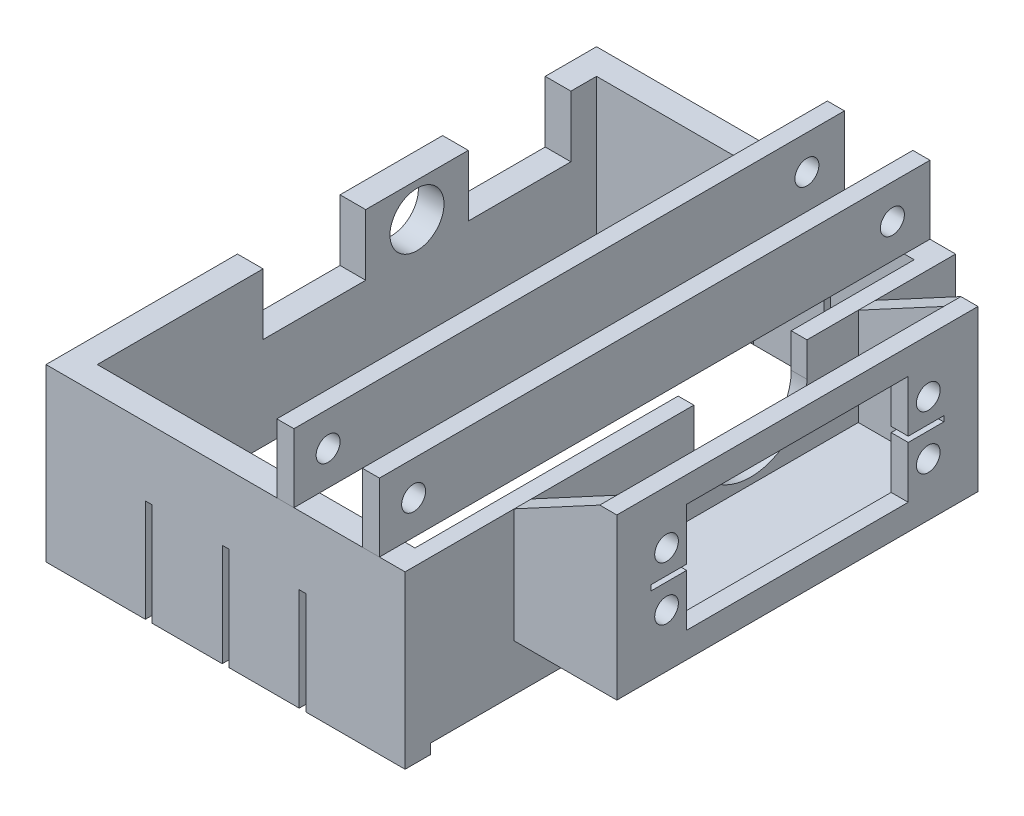
from build123d import *

# Parameters (mm, degrees)
SKETCH4_W               = 66.675
SKETCH4_H               = 102.22500002
SKETCH4_W_2             = 57.15
SKETCH4_H_2             = 92.70000002
BOSS_EXTRUDE1_DEPTH     = 19.05
BOSS_EXTRUDE2_START     = 19.05
SKETCH5_W               = 66.675
SKETCH5_H               = 102.22500002
BOSS_EXTRUDE2_DEPTH     = 12.7
FILLET1_SIZE            = 3.175
SKETCH6_W               = 1.2192
SKETCH6_H               = 19.05
CUT_EXTRUDE_THIN1_DEPTH = 118.182461581
SKETCH8_W               = 3.175
SKETCH8_H               = 12.7
BOSS_EXTRUDE3_DEPTH     = 102.22500002
BOSS_EXTRUDE3_2_DEPTH   = 102.22500002
SKETCH9_R               = 2.226999991
CUT_EXTRUDE2_DEPTH      = 81.159117158
SKETCH14_W              = 57.15
SKETCH14_H              = 92.70000002
CUT_EXTRUDE8_DEPTH      = 12.7
SKETCH26_W              = 1.8415
SKETCH26_H              = 92.70000002
CUT_EXTRUDE11_DEPTH     = 69.789091167
CUT_EXTRUDE12_START     = -2.921
SKETCH27_W              = 92.70000002
SKETCH27_H              = 1.8415
CUT_EXTRUDE12_DEPTH     = 2.921
SKETCH30_R              = 5.0165
CUT_EXTRUDE13_DEPTH     = 96.046545346
CUT_EXTRUDE16_DEPTH     = 2.921
BOSS_EXTRUDE4_DEPTH     = 19.05
SKETCH34_W              = 67.061999988
SKETCH34_H              = 29.778999878
BOSS_EXTRUDE5_DEPTH     = 3.175
CUT_EXTRUDE17_START     = 19.05
SKETCH32_R              = 2.200000045
CUT_EXTRUDE17_DEPTH     = 3.175
BOSS_EXTRUDE6_DEPTH     = 3.175
BOSS_EXTRUDE8_START     = 27.666500001
BOSS_EXTRUDE8_DEPTH     = 3.175
SKETCH36_W              = 19.05
SKETCH36_H              = 11.3665
CUT_EXTRUDE18_DEPTH     = 4.7625


# Read off the part's stored shape, not the designer's step: Boss-Extrude8
with BuildPart() as part:
    # Sketch4 → Boss-Extrude1 (new body)
    with BuildSketch(Plane(origin=(0, 0, 0), x_dir=(1, 0, 0), z_dir=(0, 1, 0))):
        Rectangle(SKETCH4_W, SKETCH4_H)
        Rectangle(SKETCH4_W_2, SKETCH4_H_2, mode=Mode.SUBTRACT)
    extrude(amount=BOSS_EXTRUDE1_DEPTH)

    # Sketch5 → Boss-Extrude2 (add)
    with BuildSketch(Plane(origin=(0, 0, 0), x_dir=(1, 0, 0), z_dir=(0, 1, 0)).offset(BOSS_EXTRUDE2_START)):
        Rectangle(SKETCH5_W, SKETCH5_H)
    extrude(amount=BOSS_EXTRUDE2_DEPTH)

    # Fillet1
    fillet1_edges = [part.edges().sort_by_distance(p)[0] for p in [
        (-28.575, 0, 0),
        (0, 0, 46.35000001),
        (28.575, 0, 0),
        (0, 0, -46.35000001),
    ]]
    chamfer(fillet1_edges, length=FILLET1_SIZE)

    # Sketch6 → Cut-Extrude-Thin1 (cut, through all)
    with BuildSketch(Plane(origin=(14.34600001, 0, 51.11250001), x_dir=(-1, 0, 0), z_dir=(0, 0, -1))):
        with Locations((14.34600001, 9.525)):
            Rectangle(SKETCH6_W, SKETCH6_H)
        with Locations((28.63350001, 9.525)):
            Rectangle(SKETCH6_W, SKETCH6_H)
        with Locations((0.05850001, 9.525)):
            Rectangle(SKETCH6_W, SKETCH6_H)
    extrude(amount=CUT_EXTRUDE_THIN1_DEPTH, mode=Mode.SUBTRACT)

    # Sketch14 → Cut-Extrude8 (cut)
    with BuildSketch(Plane.XZ.offset(-19.05)):
        Rectangle(SKETCH14_W, SKETCH14_H)
    extrude(amount=-CUT_EXTRUDE8_DEPTH, mode=Mode.SUBTRACT)

    # Sketch26 → Cut-Extrude11 (cut, through all)
    with BuildSketch(Plane(origin=(0, 31.75, 0), x_dir=(1, 0, 0), z_dir=(0, 1, 0))):
        with Locations((29.49575, 0)):
            Rectangle(SKETCH26_W, SKETCH26_H)
    extrude(amount=-CUT_EXTRUDE11_DEPTH, mode=Mode.SUBTRACT)

    # Sketch27 → Cut-Extrude12 (cut)
    with BuildSketch(Plane(origin=(33.3375, 0, 0), x_dir=(0, 0, -1), z_dir=(1, 0, 0)).offset(CUT_EXTRUDE12_START)):
        with Locations((0, 0.92075)):
            Rectangle(SKETCH27_W, SKETCH27_H)
    extrude(amount=CUT_EXTRUDE12_DEPTH, mode=Mode.SUBTRACT)

    # Sketch30 → Cut-Extrude13 (cut, through all)
    with BuildSketch(Plane.ZY.offset(33.3375)):
        with Locations((-13.01250001, 25.4)):
            Circle(SKETCH30_R)
    extrude(amount=-CUT_EXTRUDE13_DEPTH, mode=Mode.SUBTRACT)

    # Sketch31 → Cut-Extrude16 (cut)
    with BuildSketch(Plane(origin=(33.3375, 0, 0), x_dir=(0, 0, -1), z_dir=(1, 0, 0))):
        with BuildLine():
            Line((2.512500055, 25.4), (2.512500055, 31.75))
            Line((2.512500055, 31.75), (23.512499965, 31.75))
            Line((23.512499965, 31.75), (23.512499965, 25.4))
            ThreePointArc((23.512499965, 25.4), (13.01250001, 14.900000045), (2.512500055, 25.4))
        make_face()
    extrude(amount=-CUT_EXTRUDE16_DEPTH, mode=Mode.SUBTRACT)

    # Sketch33 → Boss-Extrude4 (add)
    with BuildSketch(Plane(origin=(33.3375, 0, 0), x_dir=(0, 0, -1), z_dir=(1, 0, 0))):
        Polygon((-27.666500001, 31.75), (-27.666500001, 13.685500057), (33.045499987, 13.685500057), (33.045499987, 31.75), (36.220499987, 31.75), (36.220499987, 10.510500057), (-30.841500001, 10.510500057), (-30.841500001, 31.75), align=None)
    extrude(amount=BOSS_EXTRUDE4_DEPTH)

    # Sketch34 → Boss-Extrude5 (add)
    with BuildSketch(Plane(origin=(52.3875, 0, 0), x_dir=(0, 0, -1), z_dir=(1, 0, 0))):
        with Locations((2.689499993, 25.399999996)):
            Rectangle(SKETCH34_W, SKETCH34_H)
    extrude(amount=-BOSS_EXTRUDE5_DEPTH)

    # Sketch32 → Cut-Extrude17 (cut)
    with BuildSketch(Plane(origin=(33.3375, 0, 0), x_dir=(0, 0, -1), z_dir=(1, 0, 0)).offset(CUT_EXTRUDE17_START)):
        with Locations((26.989500034, 30.400000029)):
            Circle(SKETCH32_R)
        with Locations((26.989500034, 20.399999963)):
            Circle(SKETCH32_R)
        with Locations((-21.610500048, 30.400000029)):
            Circle(SKETCH32_R)
        with Locations((-21.610500048, 20.399999963)):
            Circle(SKETCH32_R)
        Polygon((23.266499987, 15.273000057), (23.266499987, 24.899999996), (29.870499987, 24.899999996), (29.870499987, 25.899999996), (23.266499987, 25.899999996), (23.266499987, 35.526999935), (-17.887500001, 35.526999935), (-17.887500001, 25.899999996), (-24.491500001, 25.899999996), (-24.491500001, 24.899999996), (-17.887500001, 24.899999996), (-17.887500001, 15.273000057), align=None)
    extrude(amount=-CUT_EXTRUDE17_DEPTH, mode=Mode.SUBTRACT)

    # Sketch35 → Boss-Extrude6 (add)
    with BuildSketch(Plane(origin=(0, 0, -36.220499987), x_dir=(-1, 0, 0), z_dir=(0, 0, -1))):
        Polygon((-49.2125, 40.289499935), (-33.3375, 31.75), (-49.2125, 31.75), align=None)
    extrude(amount=-BOSS_EXTRUDE6_DEPTH)

    # Boss-Extrude8 outline → Boss-Extrude8 (add)
    with BuildSketch(Plane.XY.offset(BOSS_EXTRUDE8_START)):
        Polygon((49.2125, 40.289499935), (33.3375, 31.75), (49.2125, 31.75), align=None)
    extrude(amount=BOSS_EXTRUDE8_DEPTH)

    # Sketch36 → Cut-Extrude18 (cut)
    with BuildSketch(Plane.ZY.offset(33.3375)):
        with Locations((6.03749999, 26.06675)):
            Rectangle(SKETCH36_W, SKETCH36_H)
        with Locations((-32.06250001, 26.06675)):
            Rectangle(SKETCH36_W, SKETCH36_H)
    extrude(amount=-CUT_EXTRUDE18_DEPTH, mode=Mode.SUBTRACT)


with BuildPart() as body_2:
    # Sketch8 → Boss-Extrude3 (new body)
    with BuildSketch(Plane.XY.offset(51.11250001)):
        with Locations((11.1125, 38.1)):
            Rectangle(SKETCH8_W, SKETCH8_H)
    extrude(amount=-BOSS_EXTRUDE3_DEPTH)


with BuildPart() as body_3:
    # Sketch8 → Boss-Extrude3 2 (new body)
    with BuildSketch(Plane.XY.offset(51.11250001)):
        with Locations((26.9875, 38.1)):
            Rectangle(SKETCH8_W, SKETCH8_H)
    extrude(amount=-BOSS_EXTRUDE3_2_DEPTH)


with BuildPart() as cut_extrude2_tool:
    # Sketch9 → Cut-Extrude2 (new, through all)
    with BuildSketch(Plane.ZY.offset(-9.525)):
        with Locations((44.76250001, 38.1)):
            Circle(SKETCH9_R)
        with Locations((-44.13749999, 38.1)):
            Circle(SKETCH9_R)
    extrude(amount=-CUT_EXTRUDE2_DEPTH)


with BuildPart() as body_2_1:
    add(body_2.part)

    # Cut-Extrude2: cut by cut_extrude2_tool
    add(cut_extrude2_tool.part, mode=Mode.SUBTRACT)


with BuildPart() as body_3_1:
    add(body_3.part)

    # Cut-Extrude2: cut by cut_extrude2_tool
    add(cut_extrude2_tool.part, mode=Mode.SUBTRACT)


solid = Compound([part.part, body_2_1.part, body_3_1.part])
